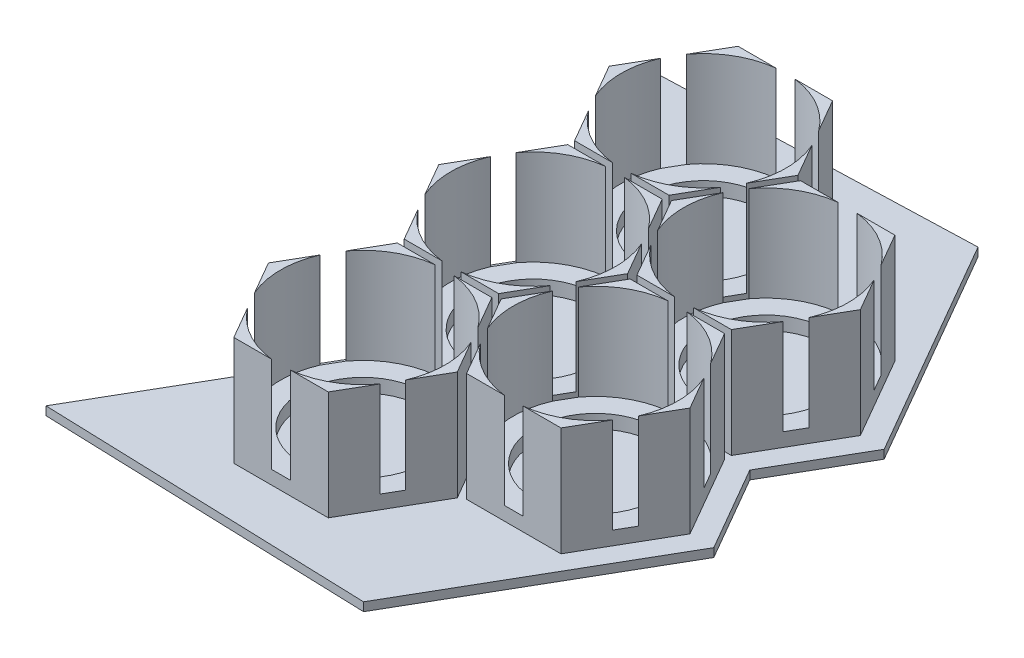
from build123d import *

# Parameters (mm, degrees)
BOSS_EXTRUDE1_DEPTH = 1
BOSS_EXTRUDE2_DEPTH = 25.4
SKETCH4_R           = 14.351
CUT_EXTRUDE1_DEPTH  = 25.4
SKETCH4_4_R         = 19.177
CUT_EXTRUDE2_DEPTH  = 22.225
LPATTERN1_COUNT     = 3
LPATTERN1_PITCH     = 78
SPLIT3_START        = -1
SPLIT3_DEPTH        = 27.4


# Read off the part's stored shape, not the designer's step: Split3
with BuildPart() as part:
    # Sketch1 → Boss-Extrude1 (new, symmetric)
    with BuildSketch(Plane(origin=(0, 0, 0), x_dir=(1, 0, 0), z_dir=(0, 1, 0))):
        Polygon((118, 0), (-118, 0), (-118, -67.135), (118, -75), align=None)
        Polygon((-118, 67.135), (-118, 0), (118, 0), (118, 75), align=None)
    extrude(amount=BOSS_EXTRUDE1_DEPTH, both=True)

    # Sketch3 → Boss-Extrude2 (add)
    with BuildSketch(Plane(origin=(0, 1, 0), x_dir=(1, 0, 0), z_dir=(0, 1, 0))):
        Polygon((-84.001477372, 20.6375), (-73.002954744, 39.6875), (-84.001477372, 58.7375), (-105.998522628, 58.7375), (-116.997045256, 39.6875), (-105.998522628, 20.6375), align=None)
        Polygon((-38.632571531, 19.84375), (-49.631094159, 0.79375), (-71.628139415, 0.79375), (-82.626662043, 19.84375), (-71.628139415, 38.89375), (-49.631094159, 38.89375), align=None)
        Polygon((-84.001477372, -19.05), (-73.002954744, 0), (-84.001477372, 19.05), (-105.998522628, 19.05), (-116.997045256, 0), (-105.998522628, -19.05), align=None)
        Polygon((-105.998522628, -58.7375), (-84.001477372, -58.7375), (-73.002954744, -39.6875), (-84.001477372, -20.6375), (-105.998522628, -20.6375), (-116.997045256, -39.6875), align=None)
        Polygon((-71.628139415, -38.89375), (-49.631094159, -38.89375), (-38.632571531, -19.84375), (-49.631094159, -0.79375), (-71.628139415, -0.79375), (-82.626662043, -19.84375), align=None)
    boss_extrude2 = extrude(amount=BOSS_EXTRUDE2_DEPTH)

    # Sketch4 → Cut-Extrude1 (cut)
    with BuildSketch(Plane(origin=(0, 26.4, 0), x_dir=(1, 0, 0), z_dir=(0, 1, 0))):
        with Locations(Location((-95, 0, 0), (0, 0, 270))):
            Circle(SKETCH4_R)
        with Locations(Location((-95, -39.6875, 0), (0, 0, 270))):
            Circle(SKETCH4_R)
        with Locations(Location((-95, 39.6875, 0), (0, 0, 90))):
            Circle(SKETCH4_R)
        with Locations(Location((-60.629616787, 19.84375, 0), (0, 0, 270))):
            Circle(SKETCH4_R)
        with Locations(Location((-60.629616787, -19.84375, 0), (0, 0, 90))):
            Circle(SKETCH4_R)
    cut_extrude1 = extrude(amount=-CUT_EXTRUDE1_DEPTH, mode=Mode.SUBTRACT)

    # Sketch4<4> → Cut-Extrude2 (cut)
    with BuildSketch(Plane(origin=(0, 26.4, 0), x_dir=(1, 0, 0), z_dir=(0, 1, 0))):
        with Locations((-95, 0)):
            Circle(SKETCH4_4_R)
        with Locations((-95, -39.6875)):
            Circle(SKETCH4_4_R)
        with Locations((-95, 39.6875)):
            Circle(SKETCH4_4_R)
        with Locations((-60.629616787, 19.84375)):
            Circle(SKETCH4_4_R)
        with Locations((-60.629616787, -19.84375)):
            Circle(SKETCH4_4_R)
    cut_extrude2 = extrude(amount=-CUT_EXTRUDE2_DEPTH, mode=Mode.SUBTRACT)

    # LPattern1: Boss-Extrude2, Cut-Extrude1, Cut-Extrude2 ×3
    with Locations(*[(i * LPATTERN1_PITCH, 0, 0) for i in range(1, LPATTERN1_COUNT)]):
        add(boss_extrude2)
        add(cut_extrude1, mode=Mode.SUBTRACT)
        add(cut_extrude2, mode=Mode.SUBTRACT)

    # Split3 outline → Split3 (cut)
    with BuildSketch(Plane(origin=(0, 0, 0), x_dir=(1, 0, 0), z_dir=(0, 1, 0)).offset(SPLIT3_START)):
        Polygon((33.456794404, 0), (44.913588808, -19.84375), (15.04996756, -71.5690593), (118, -75), (118, 75), (15.04996756, 71.5690593), (44.913588808, 19.84375), align=None)
        Polygon((-118, -67.135), (-61.477571296, -69.018681787), (-33.086411192, -19.84375), (-44.543205596, 0), (-33.086411192, 19.84375), (-61.477571296, 69.018681787), (-118, 67.135), align=None)
    extrude(amount=SPLIT3_DEPTH, mode=Mode.SUBTRACT)


solid = part.part
